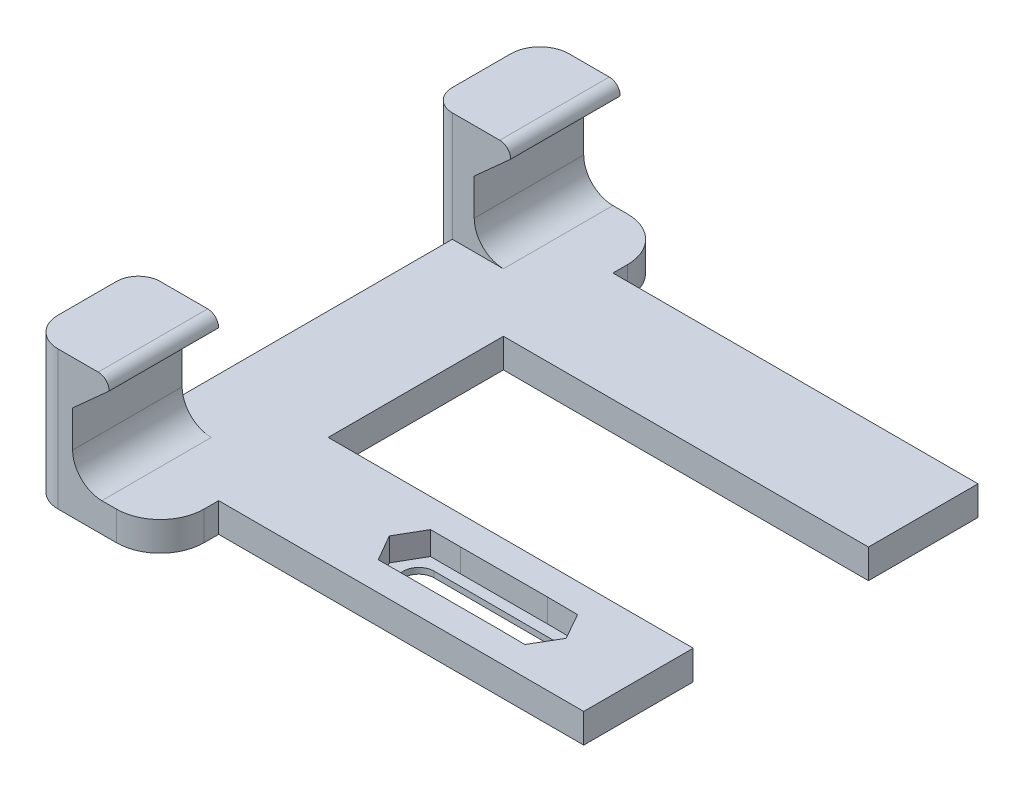
from build123d import *

# Parameters (mm, degrees)
BOSS_EXTRU_1_DEPTH      = 70
ESQUISSE5_W             = 40
ESQUISSE5_H             = 15
ENL_V_MAT_EXTRU_2_DEPTH = 10
ESQUISSE7_W             = 15
ESQUISSE7_H             = 4
BOSS_EXTRU_4_DEPTH      = 50
ENL_V_MAT_EXTRU_6_DEPTH = 3.2
ENL_V_MAT_EXTRU_7_DEPTH = 3.2
CONG_1_R                = 6
ESQUISSE19_W            = 3
ESQUISSE19_H            = 15
BOSS_EXTRU_6_DEPTH      = 19
CONG_3_R                = 4
CONG_5_R                = 3


with BuildPart() as part:
    # Esquisse1 → Boss.-Extru.1 (new body)
    with BuildSketch(Plane.XY):
        with BuildLine():
            Line((-31.982945736, 17), (-31.982945736, 0))
            Line((-31.982945736, 0), (-16.982945736, 0))
            Line((-16.982945736, 0), (-16.982945736, 4))
            Line((-16.982945736, 4), (-24.982945736, 4))
            ThreePointArc((-24.982945736, 4), (-27.811372861, 5.171572875), (-28.982945736, 8))
            Line((-28.982945736, 8), (-28.982945736, 13))
            Line((-28.982945736, 13), (-23.982945736, 17.5))
            ThreePointArc((-23.982945736, 17.5), (-24.422285565, 18.560660172), (-25.482945736, 19))
            Line((-25.482945736, 19), (-28.982945736, 19))
            Line((-28.982945736, 19), (-29.982945736, 19))
            Line((-29.982945736, 19), (-31.982945736, 19))
            Line((-31.982945736, 19), (-31.982945736, 18))
            Line((-31.982945736, 18), (-31.982945736, 17))
        make_face()
    extrude(amount=BOSS_EXTRU_1_DEPTH)

    # Esquisse5 → Enlèv. mat.-Extru.2 (cut)
    with BuildSketch(Plane.ZY.offset(31.982945736)):
        with Locations((35, 11.5)):
            Rectangle(ESQUISSE5_W, ESQUISSE5_H)
    extrude(amount=-ENL_V_MAT_EXTRU_2_DEPTH, mode=Mode.SUBTRACT)

    # Esquisse7 → Boss.-Extru.4 (add)
    with BuildSketch(Plane(origin=(-16.982945736, 0, 0), x_dir=(0, 0, -1), z_dir=(1, 0, 0))):
        with Locations((-15.5, 2)):
            Rectangle(ESQUISSE7_W, ESQUISSE7_H)
        with Locations((-54.5, 2)):
            Rectangle(ESQUISSE7_W, ESQUISSE7_H)
    extrude(amount=BOSS_EXTRU_4_DEPTH)

    # Esquisse17 → Enlèv. mat.-Extru.6 (cut)
    with BuildSketch(Plane(origin=(0, 4, 0), x_dir=(1, 0, 0), z_dir=(0, 1, 0))):
        Polygon((5.081081476, -50.925), (0.953027051, -50.925), (-1.111000161, -54.5), (0.953027051, -58.075), (5.081081476, -58.075), (7.145108688, -54.5), align=None)
        Polygon((16.921295497, -58.056491041), (5.081081476, -58.075), (7.145108688, -54.5), (5.081081476, -50.925), (16.984922057, -50.906774147), (14.88916329, -54.463265188), align=None)
        Polygon((16.921295497, -58.056491041), (21.04918647, -58.093225853), (23.144945237, -54.536734812), (21.11281303, -50.943508959), (16.984922057, -50.906774147), (14.88916329, -54.463265188), align=None)
    extrude(amount=-ENL_V_MAT_EXTRU_6_DEPTH, mode=Mode.SUBTRACT)

    # Esquisse18 → Enlèv. mat.-Extru.7 (cut)
    with BuildSketch(Plane(origin=(0, 0.8, 0), x_dir=(1, 0, 0), z_dir=(0, 1, 0))):
        with BuildLine():
            Line((19.104945237, -52.430616368), (2.928995206, -52.406118437))
            ThreePointArc((2.928995206, -52.406118437), (0.828995206, -54.506118437), (2.928995206, -56.606118437))
            Line((2.928995206, -56.606118437), (19.104945237, -56.630616368))
            ThreePointArc((19.104945237, -56.630616368), (21.204945237, -54.530616368), (19.104945237, -52.430616368))
        make_face()
    extrude(amount=-ENL_V_MAT_EXTRU_7_DEPTH, mode=Mode.SUBTRACT)

    # Congé1
    cong_1_edges = [part.edges().sort_by_distance(p)[0] for p in [
        (-16.982945736, 2, 0),
        (-16.982945736, 2, 70),
    ]]
    fillet(cong_1_edges, radius=CONG_1_R)

    # Esquisse19 → Boss.-Extru.6 (add)
    with BuildSketch(Plane.XZ):
        with Locations((-33.482945736, 62.5)):
            Rectangle(ESQUISSE19_W, ESQUISSE19_H)
        with Locations((-33.482945736, 7.5)):
            Rectangle(ESQUISSE19_W, ESQUISSE19_H)
    extrude(amount=-BOSS_EXTRU_6_DEPTH)

    # Congé3
    cong_3_edges = [part.edges().sort_by_distance(p)[0] for p in [
        (-34.982945736, 9.5, 70),
        (-34.982945736, 9.5, 0),
    ]]
    fillet(cong_3_edges, radius=CONG_3_R)

    # Congé5
    cong_5_edges = [part.edges().sort_by_distance(p)[0] for p in [
        (-34.982945736, 9.5, 55),
        (-34.982945736, 9.5, 15),
    ]]
    fillet(cong_5_edges, radius=CONG_5_R - 0.0001)  # a hair under: the kernel refuses the full size


solid = part.part
